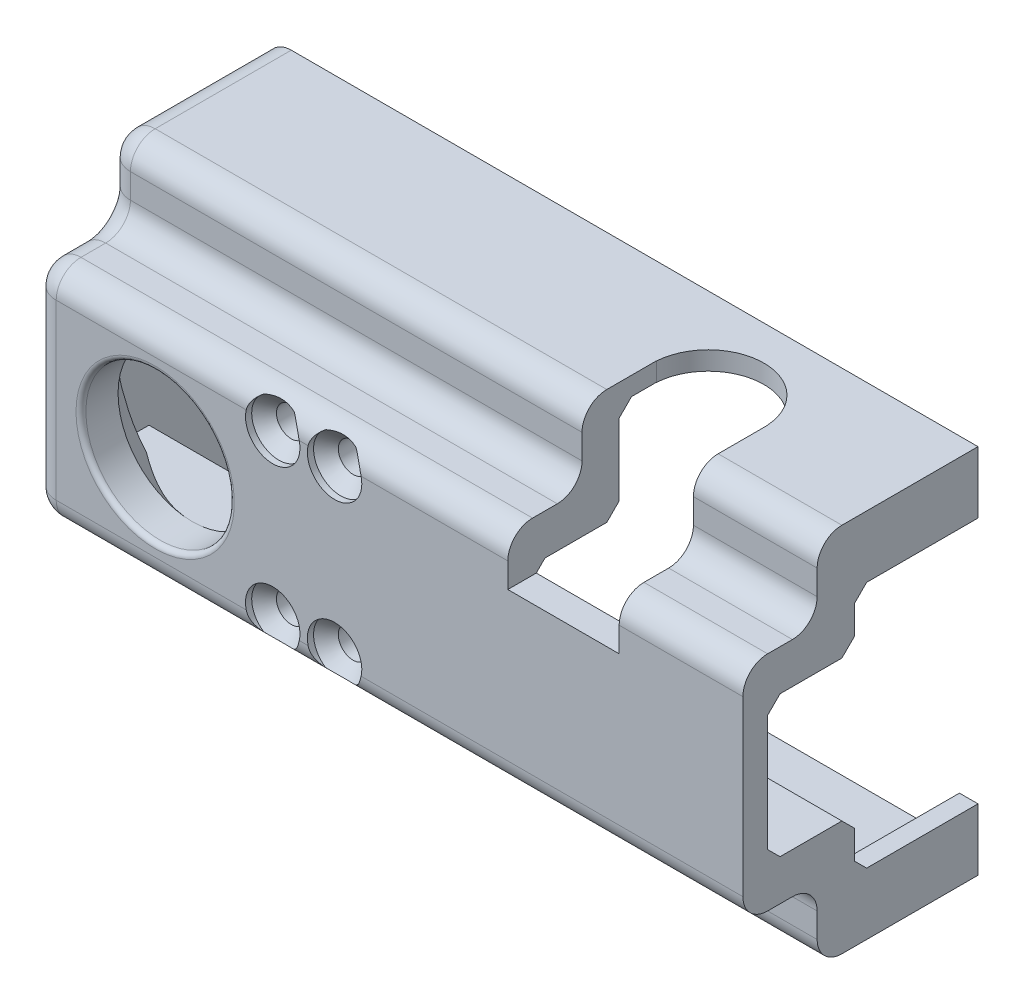
from build123d import *

# Parameters (mm, degrees)
BOSS_EXTRUDE1_DEPTH                          = 3
SKETCH2_W                                    = 40.5
SKETCH2_H                                    = 18
BOSS_EXTRUDE2_DEPTH                          = 9
SKETCH3_W                                    = 40.5
SKETCH3_H                                    = 11.4
CUT_EXTRUDE1_DEPTH                           = 7
BOSS_EXTRUDE3_DEPTH                          = 10
SKETCH5_W                                    = 14.5
SKETCH5_H                                    = 20
CUT_EXTRUDE2_DEPTH                           = 1
SKETCH8_W                                    = 10
SKETCH8_H                                    = 11.4
BOSS_EXTRUDE4_DEPTH                          = 4.7
M2_CLEARANCE_HOLE1_D                         = 2.4
M2_CLEARANCE_HOLE1_DEPTH                     = 10
CHAMFER2_SIZE                                = 0.5
CSK_FOR_M2_COUNTERSUNK_FLAT_HEAD_SCR_2_COUNT = 2
CSK_FOR_M2_COUNTERSUNK_FLAT_HEAD_SCR_2_PITCH = 13
CSK_FOR_M2_COUNTERSUNK_FLAT_HEAD_SCR_3_COUNT = 2
CSK_FOR_M2_COUNTERSUNK_FLAT_HEAD_SCR_3_PITCH = 13.928388277
CSK_FOR_M2_COUNTERSUNK_FLAT_HEAD_SCR_4_COUNT = 2
CSK_FOR_M2_COUNTERSUNK_FLAT_HEAD_SCR_4_PITCH = 5
BOSS_EXTRUDE5_DEPTH                          = 1
SKETCH17_W                                   = 13
SKETCH17_H                                   = 30
BOSS_EXTRUDE6_DEPTH                          = 1.5
SKETCH19_W                                   = 6
SKETCH19_H                                   = 18
BOSS_EXTRUDE7_DEPTH                          = 17
SKETCH20_R                                   = 6
CUT_EXTRUDE4_DEPTH                           = 10
SKETCH21_R                                   = 2.5
CUT_EXTRUDE5_DEPTH                           = 10
CHAMFER3_SIZE                                = 1
FILLET1_R                                    = 2
CHAMFER4_SIZE                                = 3
FILLET2_R                                    = 0.4
SKETCH22_R                                   = 4.5
CUT_EXTRUDE6_DEPTH                           = 10
CUT_EXTRUDE7_DEPTH                           = 33
CUT_EXTRUDE7_DEPTH_BACK                      = 6
SKETCH23_W                                   = 9
SKETCH23_H                                   = 10


# Some blends are built 0.0001 mm under size
with BuildPart() as part:
    # Sketch1 → Boss-Extrude1 (new body)
    with BuildSketch(Plane.XY):
        Polygon((14.5, -6), (14.5, 6), (0, 6), (0, 15), (55, 15), (55, -15), (0, -15), (0, -6), align=None)
    extrude(amount=BOSS_EXTRUDE1_DEPTH)

    # Sketch2 → Boss-Extrude2 (add)
    with BuildSketch(Plane(origin=(0, 0, 0), x_dir=(-1, 0, 0), z_dir=(0, 0, -1))):
        with Locations((-34.75, 0)):
            Rectangle(SKETCH2_W, SKETCH2_H)
    extrude(amount=-BOSS_EXTRUDE2_DEPTH)

    # Sketch3 → Cut-Extrude1 (cut)
    with BuildSketch(Plane(origin=(0, 0, 0), x_dir=(-1, 0, 0), z_dir=(0, 0, -1))):
        with Locations((-34.75, 0)):
            Rectangle(SKETCH3_W, SKETCH3_H)
    extrude(amount=-CUT_EXTRUDE1_DEPTH, mode=Mode.SUBTRACT)

    # Sketch4 → Boss-Extrude3 (add)
    with BuildSketch(Plane(origin=(0, 0, 0), x_dir=(-1, 0, 0), z_dir=(0, 0, -1))):
        Polygon((0, 15), (-55, 15), (-55, 10), (-53.5, 10), (-53.5, 13.5), (0, 13.5), align=None)
    boss_extrude3 = extrude(amount=BOSS_EXTRUDE3_DEPTH)

    # Sketch5 → Cut-Extrude2 (cut)
    with BuildSketch(Plane(origin=(0, 0, 0), x_dir=(-1, 0, 0), z_dir=(0, 0, -1))):
        with Locations((-7.25, 0)):
            Rectangle(SKETCH5_W, SKETCH5_H)
    extrude(amount=-CUT_EXTRUDE2_DEPTH, mode=Mode.SUBTRACT)

    # Sketch8 → Boss-Extrude4 (add)
    with BuildSketch(Plane(origin=(0, 0, 7), x_dir=(-1, 0, 0), z_dir=(0, 0, -1))):
        with Locations((-19.5, 0)):
            Rectangle(SKETCH8_W, SKETCH8_H)
    extrude(amount=BOSS_EXTRUDE4_DEPTH)

    # M2 Clearance Hole1
    with Locations(Plane(origin=(0, 0, 0), x_dir=(-1, 0, 0), z_dir=(0, 0, -1))):
        with Locations((-17, -6.5), (-22, 6.5), (-17, 6.5), (-22, -6.5)):
            Hole(M2_CLEARANCE_HOLE1_D / 2, depth=M2_CLEARANCE_HOLE1_DEPTH)

    # Mirror1: Boss-Extrude3 across plane
    add(boss_extrude3.mirror(Plane.ZX))

    # Chamfer2
    chamfer2_edges = [part.edges().sort_by_distance(p)[0] for p in [
        (23.697213596, 5.7, 2.3),
        (23.697213596, -5.7, 2.3),
        (24.5, 5.7, 4.65),
        (24.5, 0, 2.3),
        (24.5, -5.7, 4.65),
        (24.5, 0, 7),
    ]]
    chamfer(chamfer2_edges, length=CHAMFER2_SIZE)

    # Sketch14 → CSK for M2 Countersunk Flat Head Screw1 (revolve, cut)
    with BuildSketch(Plane(origin=(17, -6.5, 9), x_dir=(0, -1, 0), z_dir=(1, 0, 0))):
        Polygon((0, 0), (0, 19), (1.2, 19), (1.2, 1.5), (2.2, 0.5), (2.2, 0), align=None)
    csk_for_m2_countersunk_flat_head_screw1 = revolve(axis=Axis((17, -6.5, 15.35), (0, 0, -1)), mode=Mode.SUBTRACT)

    # CSK for M2 Countersunk Flat Head Scr 2: CSK for M2 Countersunk Flat Head Screw1 ×2
    with Locations(*[(0, i * CSK_FOR_M2_COUNTERSUNK_FLAT_HEAD_SCR_2_PITCH, 0) for i in range(1, CSK_FOR_M2_COUNTERSUNK_FLAT_HEAD_SCR_2_COUNT)]):
        add(csk_for_m2_countersunk_flat_head_screw1, mode=Mode.SUBTRACT)

    # CSK for M2 Countersunk Flat Head Scr 3: CSK for M2 Countersunk Flat Head Screw1 ×2
    with Locations(*[Vector(0.3589790793088695, 0.9333456062030594, 0) * (i * CSK_FOR_M2_COUNTERSUNK_FLAT_HEAD_SCR_3_PITCH) for i in range(1, CSK_FOR_M2_COUNTERSUNK_FLAT_HEAD_SCR_3_COUNT)]):
        add(csk_for_m2_countersunk_flat_head_screw1, mode=Mode.SUBTRACT)

    # CSK for M2 Countersunk Flat Head Scr 4: CSK for M2 Countersunk Flat Head Screw1 ×2
    with Locations(*[(i * CSK_FOR_M2_COUNTERSUNK_FLAT_HEAD_SCR_4_PITCH, 0, 0) for i in range(1, CSK_FOR_M2_COUNTERSUNK_FLAT_HEAD_SCR_4_COUNT)]):
        add(csk_for_m2_countersunk_flat_head_screw1, mode=Mode.SUBTRACT)

    # Sketch16 → Boss-Extrude5 (add)
    with BuildSketch(Plane.ZY):
        Polygon((0, 13.5), (0, 10), (1, 10), (1, 6), (3, 6), (3, 15), (-10, 15), (-10, 13.5), align=None)
    boss_extrude5 = extrude(amount=BOSS_EXTRUDE5_DEPTH)

    # Mirror2: Boss-Extrude5 across plane
    add(boss_extrude5.mirror(Plane.ZX))

    # Sketch17 → Boss-Extrude6 (add)
    with BuildSketch(Plane.ZY.offset(1)):
        with Locations((-3.5, 0)):
            Rectangle(SKETCH17_W, SKETCH17_H)
    extrude(amount=BOSS_EXTRUDE6_DEPTH)

    # Sketch19 → Boss-Extrude7 (add)
    with BuildSketch(Plane.ZY.offset(-14.5)):
        with Locations((6, 0)):
            Rectangle(SKETCH19_W, SKETCH19_H)
    extrude(amount=BOSS_EXTRUDE7_DEPTH)

    # Sketch20 → Cut-Extrude4 (cut)
    with BuildSketch(Plane(origin=(0, 0, 3), x_dir=(-1, 0, 0), z_dir=(0, 0, -1))):
        with Locations((-7.5, 0)):
            Circle(SKETCH20_R)
    extrude(amount=-CUT_EXTRUDE4_DEPTH, mode=Mode.SUBTRACT)

    # Sketch21 → Cut-Extrude5 (cut)
    with BuildSketch(Plane(origin=(-1, 0, 0), x_dir=(0, 0, -1), z_dir=(1, 0, 0))):
        with Locations((5, 0)):
            Circle(SKETCH21_R)
    extrude(amount=-CUT_EXTRUDE5_DEPTH, mode=Mode.SUBTRACT)

    # Chamfer3
    chamfer3_edges = [part.edges().sort_by_distance(p)[0] for p in [
        (38.947213596, 5.7, 0),
        (54.25, -10, 0),
        (26.25, -13.5, 0),
        (40, 5.7, 7),
        (-1, 13.5, -5),
        (-1, 11.75, 0),
        (-1, -13.5, -5),
        (-1, -11.75, 0),
        (40, -5.7, 7),
        (38.947213596, -5.7, 0),
        (54.25, 10, 0),
        (26.25, 13.5, 0),
    ]]
    chamfer(chamfer3_edges, length=CHAMFER3_SIZE - 0.0001)  # a hair under: the kernel refuses the full size

    # Fillet1
    # the kernel refuses this fillet: 2 mm, written as the material it adds along each edge
    with BuildSketch(Plane(origin=(-2.5, 9, 3), x_dir=(0, 0, 1), z_dir=(1, 0, 0)), Plane(origin=(-2.5, -9, 3), x_dir=(0, -1, 0), z_dir=(1, 0, 0))) as fillet1_piece_1:
        with BuildLine():
            CenterArc((FILLET1_R, -FILLET1_R), FILLET1_R, 90, 90)
            Line((0, -FILLET1_R), (0, 0))
            Line((0, 0), (FILLET1_R, 0))
        make_face()
    extrude(amount=57.5)
    # the kernel refuses this fillet: 2 mm, written as the material it takes off along each edge
    with BuildSketch(Plane(origin=(-7.5, -15, 3), x_dir=(0, 1, 0), z_dir=(1, 0, 0)), Plane(origin=(-7.5, 9, 9), x_dir=(0, 0, -1), z_dir=(1, 0, 0)), Plane(origin=(-7.5, -9, 9), x_dir=(0, 1, 0), z_dir=(1, 0, 0))) as fillet1_2_piece_1:
        with BuildLine():
            CenterArc((FILLET1_R, -FILLET1_R), FILLET1_R, 90, 90)
            Line((0, -FILLET1_R), (0, 0))
            Line((0, 0), (FILLET1_R, 0))
        make_face()
    extrude(amount=67.5, mode=Mode.SUBTRACT)
    with BuildSketch(Plane(origin=(60, 15, 3), x_dir=(0, 0, -1), z_dir=(-1, 0, 0))) as fillet1_2_piece_2:
        with BuildLine():
            CenterArc((FILLET1_R, FILLET1_R), FILLET1_R, 180, 90)
            Line((0, FILLET1_R), (0, 0))
            Line((0, 0), (FILLET1_R, 0))
        make_face()
    extrude(amount=67.5, mode=Mode.SUBTRACT)
    with BuildSketch(Plane(origin=(-2.5, -15, 8), x_dir=(1, 0, 0), z_dir=(0, 0, -1)), Plane(origin=(-2.5, 15, -15), x_dir=(1, 0, 0), z_dir=(0, 0, 1))) as fillet1_2_piece_3:
        with BuildLine():
            CenterArc((FILLET1_R, -FILLET1_R), FILLET1_R, 90, 90)
            Line((0, -FILLET1_R), (0, 0))
            Line((0, 0), (FILLET1_R, 0))
        make_face()
    extrude(amount=23, mode=Mode.SUBTRACT)
    with BuildSketch(Plane(origin=(-2.5, -14, 9), x_dir=(1, 0, 0), z_dir=(0, 1, 0))) as fillet1_2_piece_4:
        with BuildLine():
            CenterArc((FILLET1_R, FILLET1_R), FILLET1_R, 180, 90)
            Line((0, FILLET1_R), (0, 0))
            Line((0, 0), (FILLET1_R, 0))
        make_face()
    extrude(amount=28, mode=Mode.SUBTRACT)
    # the kernel refuses this fillet: 2 mm, written as the material it takes off along each edge
    with BuildSketch(Plane(origin=(-0.5, 7, 7), x_dir=(-1, 0, 0), z_dir=(0, 1, 0))) as fillet1_3_piece_1_section:
        Polygon((0, 0), (FILLET1_R, 0), (FILLET1_R, FILLET1_R), (0, FILLET1_R), align=None)
    fillet1_3_piece_1 = extrude(amount=FILLET1_R, mode=Mode.PRIVATE)
    fillet1_3_piece_1 = fillet1_3_piece_1 - Plane(origin=(-0.5, 7, 7), x_dir=(0.7071067811865475, 0, -0.7071067811865475), z_dir=(0, 1, 0)) * Sphere(FILLET1_R, mode=Mode.PRIVATE)
    add(fillet1_3_piece_1, mode=Mode.SUBTRACT)
    with BuildSketch(Plane(origin=(-0.5, -7, 7), x_dir=(-1, 0, 0), z_dir=(0, -1, 0))) as fillet1_3_piece_2_section:
        Polygon((0, 0), (FILLET1_R, 0), (FILLET1_R, -FILLET1_R), (0, -FILLET1_R), align=None)
    fillet1_3_piece_2 = extrude(amount=FILLET1_R, mode=Mode.PRIVATE)
    fillet1_3_piece_2 = fillet1_3_piece_2 - Plane(origin=(-0.5, -7, 7), x_dir=(0.7071067811865475, 0, -0.7071067811865475), z_dir=(0, -1, 0)) * Sphere(FILLET1_R, mode=Mode.PRIVATE)
    add(fillet1_3_piece_2, mode=Mode.SUBTRACT)
    with BuildSketch(Plane(origin=(-0.5, 13, 1), x_dir=(-1, 0, 0), z_dir=(0, 0, 1))) as fillet1_3_piece_3_section:
        Polygon((0, 0), (FILLET1_R, 0), (FILLET1_R, -FILLET1_R), (0, -FILLET1_R), align=None)
    fillet1_3_piece_3 = extrude(amount=FILLET1_R, mode=Mode.PRIVATE)
    fillet1_3_piece_3 = fillet1_3_piece_3 - Plane(origin=(-0.5, 13, 1), x_dir=(0.7071067811865475, -0.7071067811865475, 0), z_dir=(0, 0, 1)) * Sphere(FILLET1_R, mode=Mode.PRIVATE)
    add(fillet1_3_piece_3, mode=Mode.SUBTRACT)
    with BuildSketch(Plane(origin=(-0.5, -13, 1), x_dir=(-1, 0, 0), z_dir=(0, 0, 1))) as fillet1_3_piece_4_section:
        Polygon((0, 0), (FILLET1_R, 0), (FILLET1_R, FILLET1_R), (0, FILLET1_R), align=None)
    fillet1_3_piece_4 = extrude(amount=FILLET1_R, mode=Mode.PRIVATE)
    fillet1_3_piece_4 = fillet1_3_piece_4 - Plane(origin=(-0.5, -13, 1), x_dir=(0.7071067811865475, 0.7071067811865475, 0), z_dir=(0, 0, 1)) * Sphere(FILLET1_R, mode=Mode.PRIVATE)
    add(fillet1_3_piece_4, mode=Mode.SUBTRACT)
    with BuildSketch(Plane(origin=(-2.5, -11, 3), x_dir=(1, 0, 0), z_dir=(0, -1, 0)), Plane(origin=(-2.5, 13, 3), x_dir=(1, 0, 0), z_dir=(0, -1, 0))) as fillet1_3_piece_5:
        with BuildLine():
            CenterArc((FILLET1_R, -FILLET1_R), FILLET1_R, 90, 90)
            Line((0, -FILLET1_R), (0, 0))
            Line((0, 0), (FILLET1_R, 0))
        make_face()
    extrude(amount=2, mode=Mode.SUBTRACT)
    with BuildSketch(Plane(origin=(-2.5, -9, 5), x_dir=(1, 0, 0), z_dir=(0, 0, 1)), Plane(origin=(-2.5, 9, 7), x_dir=(1, 0, 0), z_dir=(0, 0, -1))) as fillet1_3_piece_6:
        with BuildLine():
            CenterArc((FILLET1_R, FILLET1_R), FILLET1_R, 180, 90)
            Line((0, FILLET1_R), (0, 0))
            Line((0, 0), (FILLET1_R, 0))
        make_face()
    extrude(amount=2, mode=Mode.SUBTRACT)
    with BuildSketch(Plane(origin=(-2.5, 11, 5), x_dir=(0, -1, 0), z_dir=(0, 0, 1))) as fillet1_3_piece_7:
        with BuildLine():
            CenterArc((2 + FILLET1_R, FILLET1_R), FILLET1_R, 180, 90)
            Line((2 + FILLET1_R, 0), (2, 0))
            Line((2, 0), (2, FILLET1_R))
        make_face()
    revolve(axis=Axis((-2.5, 11, 5), (1, 0, 0)), revolution_arc=90, mode=Mode.SUBTRACT)
    with BuildSketch(Plane(origin=(-2.5, -11, 5), x_dir=(0, 0, -1), z_dir=(0, -1, 0))) as fillet1_3_piece_8:
        with BuildLine():
            CenterArc((2 + FILLET1_R, FILLET1_R), FILLET1_R, 180, 90)
            Line((2 + FILLET1_R, 0), (2, 0))
            Line((2, 0), (2, FILLET1_R))
        make_face()
    revolve(axis=Axis((-2.5, -11, 5), (1, 0, 0)), revolution_arc=90, mode=Mode.SUBTRACT)

    # Chamfer4
    # the kernel refuses this chamfer: 3 mm, written as the material it takes off along each edge
    with BuildSketch(Plane(origin=(7.5, 0, 3), x_dir=(0, 1, 0), z_dir=(-1, 0, 0))) as chamfer4_piece_1_section:
        Polygon((6, -CHAMFER4_SIZE), (6 + CHAMFER4_SIZE, 0), (6, 0), align=None)
    chamfer4_piece_1 = revolve(axis=Axis((7.5, 0, 3), (0, 0, -1)), revolution_arc=180, mode=Mode.PRIVATE)
    chamfer4_piece_1 = split(chamfer4_piece_1, bisect_by=Plane(origin=(14.5, 5.605916994, 5.473155371), z_dir=(-1, 0, 0)), keep=Keep.TOP, mode=Mode.PRIVATE)
    chamfer4_piece_1 = split(chamfer4_piece_1, bisect_by=Plane(origin=(10.736577685, 6, 5.473155371), z_dir=(0, -1, 0)), keep=Keep.TOP, mode=Mode.PRIVATE)
    chamfer4_piece_1 = split(chamfer4_piece_1, bisect_by=Plane(origin=(10.736577685, -6, 5.473155371), z_dir=(0, 1, 0)), keep=Keep.TOP, mode=Mode.PRIVATE)
    add(chamfer4_piece_1, mode=Mode.SUBTRACT)
    with BuildSketch(Plane(origin=(7.5, 0, 3), x_dir=(-1, 0, 0), z_dir=(0, -1, 0))) as chamfer4_piece_2_section:
        Polygon((6, -CHAMFER4_SIZE), (6 + CHAMFER4_SIZE, 0), (6, 0), align=None)
    chamfer4_piece_2 = revolve(axis=Axis((7.5, 0, 3), (0, 0, -1)), revolution_arc=90, mode=Mode.PRIVATE)
    chamfer4_piece_2 = split(chamfer4_piece_2, bisect_by=Plane(origin=(-1, 3.372214082, 4.030429056), z_dir=(1, 0, 0)), keep=Keep.TOP, mode=Mode.PRIVATE)
    chamfer4_piece_2 = split(chamfer4_piece_2, bisect_by=Plane(origin=(1.857456627, 6, 4.030429056), z_dir=(0, -1, 0)), keep=Keep.TOP, mode=Mode.PRIVATE)
    add(chamfer4_piece_2, mode=Mode.SUBTRACT)
    with BuildSketch(Plane(origin=(7.5, 0, 3), x_dir=(0, -1, 0), z_dir=(1, 0, 0))) as chamfer4_piece_3_section:
        Polygon((6, -CHAMFER4_SIZE), (6 + CHAMFER4_SIZE, 0), (6, 0), align=None)
    chamfer4_piece_3 = revolve(axis=Axis((7.5, 0, 3), (0, 0, -1)), revolution_arc=90, mode=Mode.PRIVATE)
    chamfer4_piece_3 = split(chamfer4_piece_3, bisect_by=Plane(origin=(-1, -3.372214082, 4.030429056), z_dir=(1, 0, 0)), keep=Keep.TOP, mode=Mode.PRIVATE)
    chamfer4_piece_3 = split(chamfer4_piece_3, bisect_by=Plane(origin=(1.857456627, -6, 4.030429056), z_dir=(0, 1, 0)), keep=Keep.TOP, mode=Mode.PRIVATE)
    add(chamfer4_piece_3, mode=Mode.SUBTRACT)

    # Fillet2
    fillet2_edges = [part.edges().sort_by_distance(p)[0] for p in [
        (13.5, 0, 9),
    ]]
    fillet(fillet2_edges, radius=FILLET2_R)

    # Sketch22 → Cut-Extrude6 (cut)
    with BuildSketch(Plane.XZ.offset(-13.5)):
        with Locations(Location((40.5, -2.7, 0), (0, 0, 157.803899143))):
            Circle(SKETCH22_R)
    extrude(amount=-CUT_EXTRUDE6_DEPTH, mode=Mode.SUBTRACT)

    # Sketch23 → Cut-Extrude7 (cut, two sides: drawn at the far end of the back side and taken through both)
    with BuildSketch(Plane.XY.offset(3).offset(-CUT_EXTRUDE7_DEPTH_BACK)):
        with Locations((40.5, 10)):
            Rectangle(SKETCH23_W, SKETCH23_H)
    extrude(amount=CUT_EXTRUDE7_DEPTH + CUT_EXTRUDE7_DEPTH_BACK, mode=Mode.SUBTRACT)


solid = part.part
